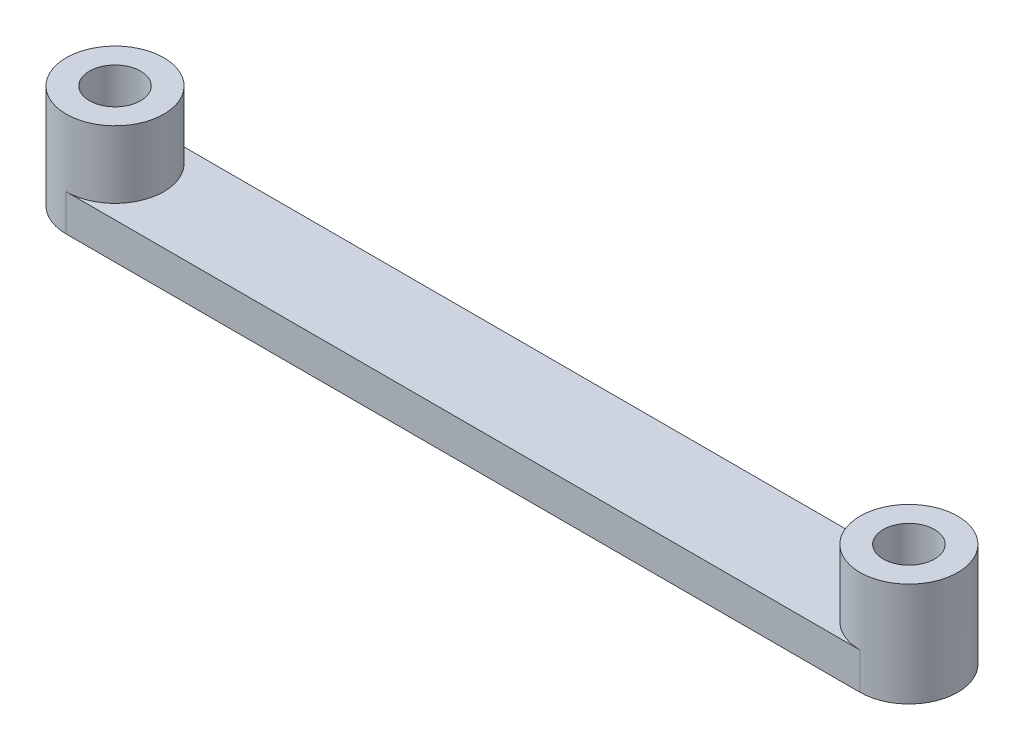
from build123d import *
from build123d.topology import SkipClean

# Parameters (mm, degrees)
BOSS_EXTRUDE1_DEPTH = 3
SKETCH3_R           = 4
BOSS_EXTRUDE2_DEPTH = 5.5
SKETCH4_R           = 2.1
CUT_EXTRUDE1_DEPTH  = 70.636556492


with BuildPart() as part:
    # Sketch1 → Boss-Extrude1 (new body)
    with BuildSketch(Plane(origin=(0, 0, 0), x_dir=(1, 0, 0), z_dir=(0, 1, 0))):
        with BuildLine():
            Line((0, 4), (65, 4))
            ThreePointArc((65, 4), (69, 0), (65, -4))
            Line((65, -4), (0, -4))
            ThreePointArc((0, -4), (-4, 0), (0, 4))
        make_face()
    extrude(amount=BOSS_EXTRUDE1_DEPTH)

    # Sketch3 → Boss-Extrude2 (add)
    with SkipClean():  # the faces are left unmerged after this step: merging them gives an invalid solid
        with BuildSketch(Plane(origin=(0, 3, 0), x_dir=(1, 0, 0), z_dir=(0, 1, 0))):
            Circle(SKETCH3_R)
            with Locations((65, 0)):
                Circle(SKETCH3_R)
        extrude(amount=BOSS_EXTRUDE2_DEPTH)

    # Sketch4 → Cut-Extrude1 (cut, through all)
    with SkipClean():  # the faces are left unmerged after this step: merging them gives an invalid solid
        with BuildSketch(Plane(origin=(0, 8.5, 0), x_dir=(1, 0, 0), z_dir=(0, 1, 0))):
            Circle(SKETCH4_R)
            with Locations((65, 0)):
                Circle(SKETCH4_R)
        extrude(amount=-CUT_EXTRUDE1_DEPTH, mode=Mode.SUBTRACT)


solid = part.part
